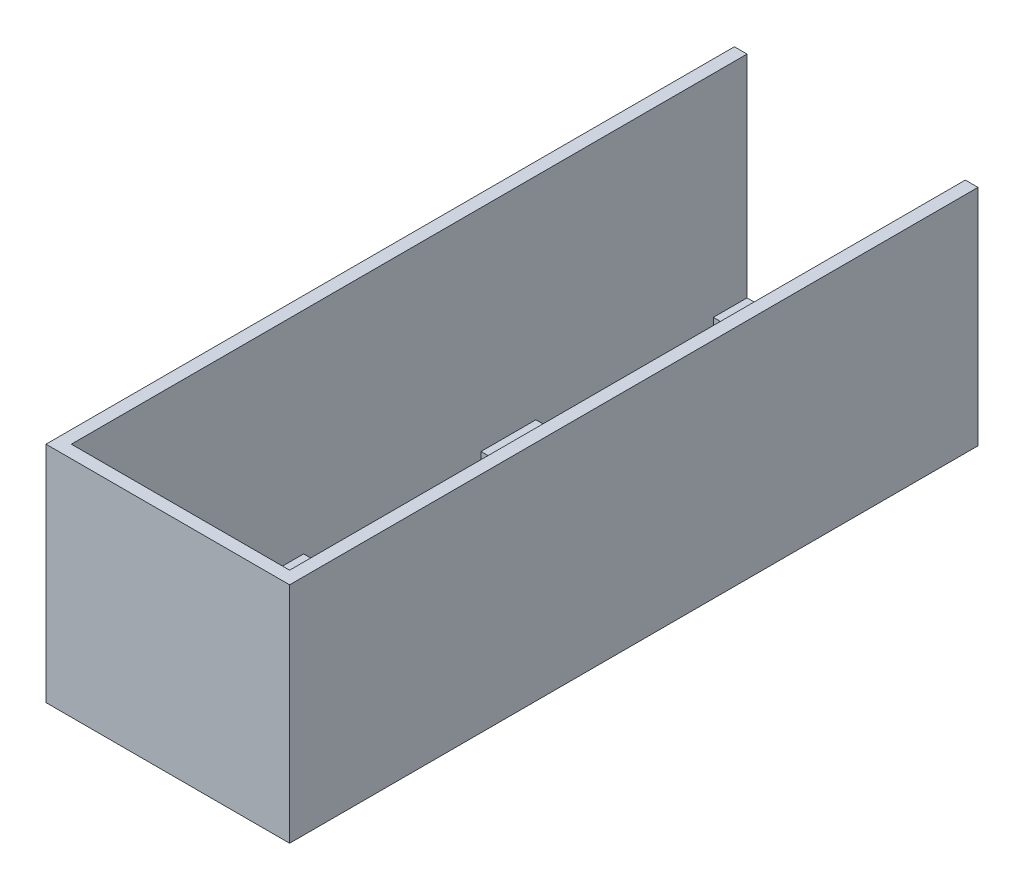
from build123d import *

# Parameters (mm, degrees)
BOSS_EXTRUDE1_DEPTH = 160
SKETCH2_W           = 45
SKETCH2_H           = 42
CUT_EXTRUDE1_DEPTH  = 178.196915782
BOSS_EXTRUDE2_DEPTH = 3


with BuildPart() as part:
    # Sketch1 → Boss-Extrude1 (new body)
    with BuildSketch(Plane.XY):
        Polygon((0, 0), (0, -20), (0, -50), (51.678578647, -50), (51.678578647, 0), (54.678578647, 0), (54.678578647, -53), (-3, -53), (-3, -20), (-3, 0), align=None)
    extrude(amount=BOSS_EXTRUDE1_DEPTH)

    # Sketch2 → Cut-Extrude1 (cut, through all)
    with BuildSketch(Plane(origin=(0, 0, 0), x_dir=(1, 0, 0), z_dir=(0, 1, 0))):
        with Locations((22.5, -29)):
            Rectangle(SKETCH2_W, SKETCH2_H)
        with Locations((22.5, -84)):
            Rectangle(SKETCH2_W, SKETCH2_H)
        with Locations((22.5, -139)):
            Rectangle(SKETCH2_W, SKETCH2_H)
    extrude(amount=-CUT_EXTRUDE1_DEPTH, mode=Mode.SUBTRACT)

    # Sketch3 → Boss-Extrude2 (add)
    with BuildSketch(Plane.XY.offset(160)):
        Polygon((-3, 0), (54.678578647, 0), (54.678578647, -53), (0, -53), (-3, -53), align=None)
    extrude(amount=BOSS_EXTRUDE2_DEPTH)


solid = part.part
